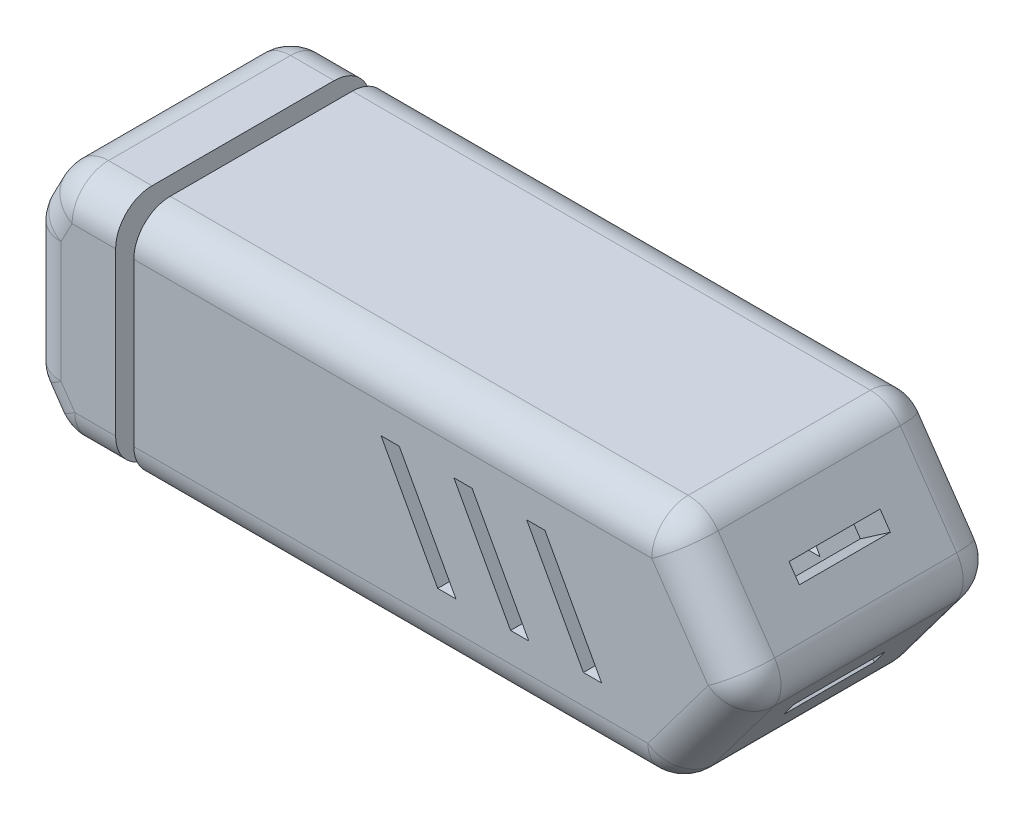
from build123d import *

# Parameters (mm, degrees)
BOSS_EXTRUDE1_DEPTH = 70
FILLET1_R           = 10
SKETCH4_R           = 44.565838739
SKETCH4_R_2         = 21.950927137
CUT_EXTRUDE18_DEPTH = 5
SHELL2_START        = 10
SHELL2_DEPTH        = 50
SHELL2_START_2      = -77.141831355
SHELL2_2_OUTLINE_R  = 11.950927137
SHELL2_2_DEPTH      = 25
SKETCH2_R           = 10
CUT_EXTRUDE19_DEPTH = 30
SKETCH10_R          = 7.386058148
CUT_EXTRUDE22_DEPTH = 33
CUT_EXTRUDE23_DEPTH = 131.776604246
SKETCH16_W          = 25
SKETCH16_H          = 5
CUT_EXTRUDE25_DEPTH = 16.122153735
SKETCH17_W          = 25
SKETCH17_H          = 5
CUT_EXTRUDE26_DEPTH = 16.122153735


with BuildPart() as part:
    # Sketch1 → Boss-Extrude1 (new body)
    with BuildSketch(Plane.XY):
        Polygon((-85.15522278, 32.602281584), (85.31682344, 32.602281584), (107.858168645, -0.126017705), (84.012402994, -31.916476628), (-83.600577489, -31.916476628), (-92.141831355, -19.515233034), (-92.141831355, 19.263197625), align=None)
    extrude(amount=BOSS_EXTRUDE1_DEPTH)

    # Fillet1
    fillet1_edges = [part.edges().sort_by_distance(p)[0] for p in [
        (-88.648527067, 25.932739604, 0),
        (-85.15522278, 32.602281584, 35),
        (85.31682344, 32.602281584, 35),
        (107.858168645, -0.126017705, 35),
        (-87.871204422, -25.715854831, 70),
        (84.012402994, -31.916476628, 35),
        (-83.600577489, -31.916476628, 35),
        (-92.141831355, -19.515233034, 35),
        (-92.141831355, 19.263197625, 35),
        (0.205912752, -31.916476628, 70),
        (95.93528582, -16.021247166, 70),
        (96.587496042, 16.23813194, 70),
        (0.08080033, 32.602281584, 70),
        (-88.648527067, 25.932739604, 70),
        (0.08080033, 32.602281584, 0),
        (96.587496042, 16.23813194, 0),
        (95.93528582, -16.021247166, 0),
        (0.205912752, -31.916476628, 0),
        (-92.141831355, -0.126017705, 70),
        (-87.871204422, -25.715854831, 0),
        (-92.141831355, -0.126017705, 0),
    ]]
    fillet(fillet1_edges, radius=FILLET1_R)

    # Sketch4 → Cut-Extrude18 (cut)
    with BuildSketch(Plane(origin=(-62.141831355, 0, 0), x_dir=(0, 0, -1), z_dir=(1, 0, 0))):
        with Locations((-35, -0.126017705)):
            Circle(SKETCH4_R)
        with Locations(Location((-35, -0.126017705, 0), (0, 0, 90))):
            Circle(SKETCH4_R_2, mode=Mode.SUBTRACT)
    extrude(amount=-CUT_EXTRUDE18_DEPTH, mode=Mode.SUBTRACT)

    # Shell2: read off the stored shape, not the designer's step
    # Shell2 outline → Shell2 (cut)
    with BuildSketch(Plane.XY.offset(SHELL2_START)):
        Polygon((-78.345650785, -21.916476628), (-77.141831355, -21.916476628), (-77.141831355, 22.602281584), (-79.104276607, 22.602281584), (-82.141831355, 16.80287299), (-82.141831355, -16.404714454), align=None)
        Polygon((-52.141831355, -21.916476628), (79.012770562, -21.916476628), (95.544357754, 0.122939143), (80.061896735, 22.602281584), (-52.141831355, 22.602281584), align=None)
    extrude(amount=SHELL2_DEPTH, mode=Mode.SUBTRACT)

    # Shell2 2 outline → Shell2 2 (cut)
    with BuildSketch(Plane.YZ.offset(SHELL2_START_2)):
        with Locations((-0.126017705, 35)):
            Circle(SHELL2_2_OUTLINE_R)
    extrude(amount=SHELL2_2_DEPTH, mode=Mode.SUBTRACT)

    # Sketch2 → Cut-Extrude19 (cut)
    with BuildSketch(Plane.ZY.offset(92.141831355)):
        with Locations(Location((35, -0.126017705, 0), (0, 0, 270))):
            Circle(SKETCH2_R)
    extrude(amount=-CUT_EXTRUDE19_DEPTH, mode=Mode.SUBTRACT)

    # Sketch10 → Cut-Extrude22 (cut)
    with BuildSketch(Plane(origin=(7.840565514, -44.466056654, 0), x_dir=(0, 0, 1), z_dir=(0.17364817766693072, -0.984807753012208, 0))):
        with Locations(Location((35.616590305, -27.492158059, 0), (0, 0, 270))):
            Circle(SKETCH10_R)
    extrude(amount=-CUT_EXTRUDE22_DEPTH, mode=Mode.SUBTRACT)

    # Sketch11 → Cut-Extrude23 (cut, through all)
    with BuildSketch(Plane.XY.offset(70)):
        Polygon((25.724647203, 14.602281584), (30.724647203, 14.602281584), (46.292543401, -13.916476628), (41.292543401, -13.916476628), align=None)
        Polygon((21.292543401, -13.916476628), (26.292543401, -13.916476628), (10.724647203, 14.602281584), (5.724647203, 14.602281584), align=None)
        Polygon((45.724647203, 14.602281584), (61.292543401, -13.916476628), (66.292543401, -13.916476628), (50.724647203, 14.602281584), align=None)
    extrude(amount=-CUT_EXTRUDE23_DEPTH, mode=Mode.SUBTRACT)

    # Sketch16 → Cut-Extrude25 (cut)
    with BuildSketch(Plane(origin=(73.09679987, 50.344815805, 0), x_dir=(0, 0, -1), z_dir=(0.8235642198480575, 0.5672230388357482, 0))):
        with Locations((-35, -41.547421266)):
            Rectangle(SKETCH16_W, SKETCH16_H)
    extrude(amount=-CUT_EXTRUDE25_DEPTH, mode=Mode.SUBTRACT)

    # Sketch17 → Cut-Extrude26 (cut)
    with BuildSketch(Plane(origin=(69.08362881, -51.819070211, 0), x_dir=(0, 0, -1), z_dir=(0.7999647115864142, -0.600047048335766, 0))):
        with Locations((-35, 43.629456832)):
            Rectangle(SKETCH17_W, SKETCH17_H)
    extrude(amount=-CUT_EXTRUDE26_DEPTH, mode=Mode.SUBTRACT)


solid = part.part
